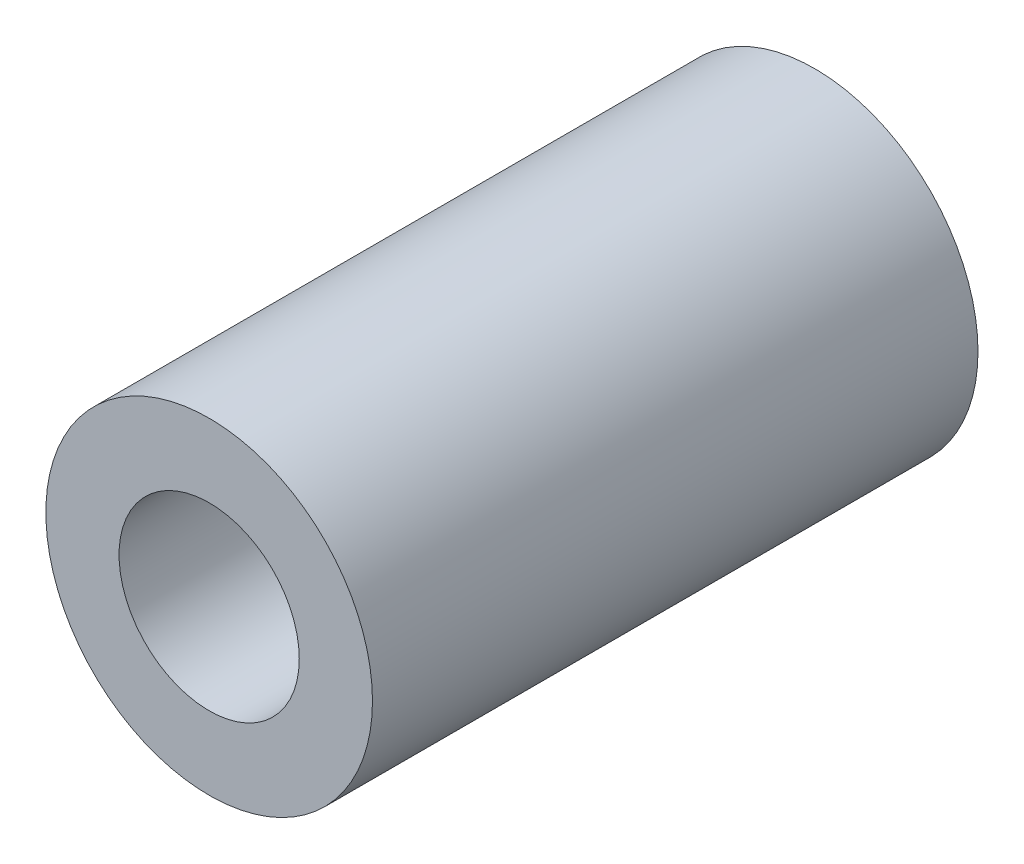
from build123d import *

# Parameters (mm, degrees)
SKETCH1_R               = 11.509375
BOSS_EXTRUDE1_DEPTH     = 42.672
CUT_EXTRUDE1_DEPTH      = 46.670898938
CUT_EXTRUDE1_DEPTH_BACK = 46.670898938
SKETCH2_R               = 6.35


with BuildPart() as part:
    # Sketch1 → Boss-Extrude1 (new body)
    with BuildSketch(Plane.XY):
        Circle(SKETCH1_R)
    extrude(amount=BOSS_EXTRUDE1_DEPTH)

    # Sketch2 → Cut-Extrude1 (cut, two sides: drawn at the far end of the back side and taken through both)
    with BuildSketch(Plane.XY.offset(42.672).offset(-CUT_EXTRUDE1_DEPTH_BACK)):
        Circle(SKETCH2_R)
    extrude(amount=CUT_EXTRUDE1_DEPTH + CUT_EXTRUDE1_DEPTH_BACK, mode=Mode.SUBTRACT)


solid = part.part
